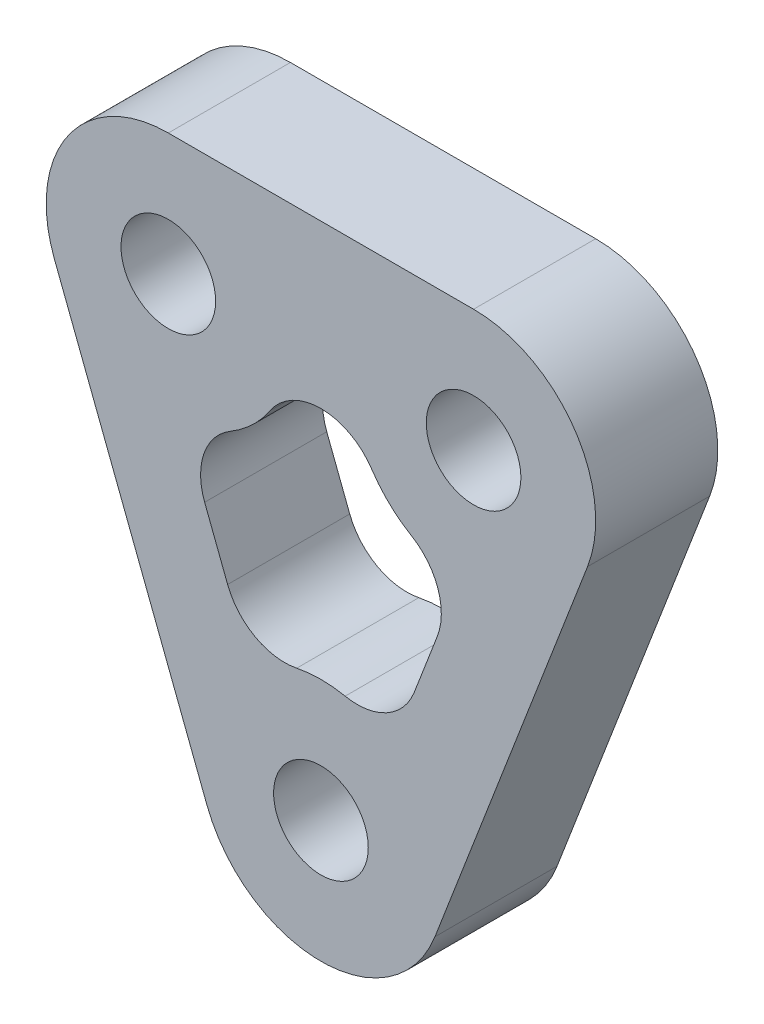
from build123d import *

# Parameters (mm, degrees)
SKETCH_1_R      = 4
SKETCH_1_R_2    = 1.55
EXTRUDE_1_DEPTH = 4
FILLET_1_R      = 2
FILLET_2_R      = 2


with BuildPart() as part:
    # 草图1 → 凸台-拉伸1 (new body)
    # profile 1 of 8: a face of its own
    with BuildSketch(Plane.XY):
        with BuildLine():
            ThreePointArc((-3.733382425, -1.435916317), (-3.830813532, 1.151028966), (-2.323665602, 3.25585291))
            Line((-2.323665602, 3.25585291), (-4.54302561, 9.026188932))
            ThreePointArc((-4.54302561, 9.026188932), (-7.072182387, 9.578587988), (-8.733382425, 11.564083683))
            Line((-8.733382425, 11.564083683), (-3.733382425, -1.435916317))
        make_face()
    # profile 2 of 8: a face of its own
    with BuildSketch(Plane.XY):
        with BuildLine():
            Line((4.54302561, 9.026188932), (2.323665602, 3.25585291))
            ThreePointArc((2.323665602, 3.25585291), (3.556308649, 1.831029436), (4, 0))
            ThreePointArc((4, 0), (3.932780804, -0.730229519), (3.733382425, -1.435916317))
            Line((3.733382425, -1.435916317), (8.733382425, 11.564083683))
            ThreePointArc((8.733382425, 11.564083683), (7.072182387, 9.578587988), (4.54302561, 9.026188932))
        make_face()
    # profile 3 of 8: a face of its own
    with BuildSketch(Plane.XY):
        with Locations((5, 13)):
            Circle(SKETCH_1_R)
        with Locations((5, 13)):
            Circle(SKETCH_1_R_2, mode=Mode.SUBTRACT)
    # profile 4 of 8: a face of its own
    with BuildSketch(Plane.XY):
        with Locations((-5, 13)):
            Circle(SKETCH_1_R)
        with Locations((-5, 13)):
            Circle(SKETCH_1_R_2, mode=Mode.SUBTRACT)
    # profile 5 of 8: a face of its own
    with BuildSketch(Plane.XY):
        with BuildLine():
            Line((-1, 13), (0, 13))
            Line((0, 13), (0, 17))
            Line((0, 17), (-5, 17))
            ThreePointArc((-5, 17), (-2.171572875, 15.828427125), (-1, 13))
        make_face()
    # profile 6 of 8: a face of its own
    with BuildSketch(Plane.XY):
        with BuildLine():
            Line((0, 17), (0, 13))
            Line((0, 13), (1, 13))
            ThreePointArc((1, 13), (2.171572875, 15.828427125), (5, 17))
            Line((5, 17), (0, 17))
        make_face()
    # profile 7 of 8: a face of its own
    with BuildSketch(Plane.XY):
        with BuildLine():
            ThreePointArc((2.323665602, 3.25585291), (1.219956631, 3.809423292), (0, 4))
            ThreePointArc((0, 4), (-1.219956631, 3.809423292), (-2.323665602, 3.25585291))
            ThreePointArc((-2.323665602, 3.25585291), (-3.830813532, 1.151028966), (-3.733382425, -1.435916317))
            ThreePointArc((-3.733382425, -1.435916317), (0, -4), (3.733382425, -1.435916317))
            ThreePointArc((3.733382425, -1.435916317), (3.932780804, -0.730229519), (4, 0))
            ThreePointArc((4, 0), (3.556308649, 1.831029436), (2.323665602, 3.25585291))
        make_face()
        with BuildLine():
            ThreePointArc((1.55, 0), (-1.096015511, -1.096015511), (0, 1.55))
            ThreePointArc((0, 1.55), (1.096015511, 1.096015511), (1.55, 0))
        make_face(mode=Mode.SUBTRACT)
    # profile 8 of 8: a face of its own
    with BuildSketch(Plane.XY):
        with BuildLine():
            ThreePointArc((2.323665602, 3.25585291), (1.219956631, 3.809423292), (0, 4))
            ThreePointArc((0, 4), (-1.219956631, 3.809423292), (-2.323665602, 3.25585291))
            ThreePointArc((-2.323665602, 3.25585291), (-3.830813532, 1.151028966), (-3.733382425, -1.435916317))
            ThreePointArc((-3.733382425, -1.435916317), (0, -4), (3.733382425, -1.435916317))
            ThreePointArc((3.733382425, -1.435916317), (3.932780804, -0.730229519), (4, 0))
            ThreePointArc((4, 0), (3.556308649, 1.831029436), (2.323665602, 3.25585291))
        make_face()
        with BuildLine():
            ThreePointArc((1.55, 0), (-1.096015511, -1.096015511), (0, 1.55))
            ThreePointArc((0, 1.55), (1.096015511, 1.096015511), (1.55, 0))
        make_face(mode=Mode.SUBTRACT)
    extrude(amount=EXTRUDE_1_DEPTH)

    # 圆角1
    # the kernel refuses this fillet: 2 mm, written as the material it adds along each edge
    with BuildSketch(Plane(origin=(-4.54302561, 9.026188932, 0), x_dir=(0.9477918493687586, 0.3188896521841818, 0), z_dir=(0, 0, 1))) as fillet_1_piece_1:
        with BuildLine():
            CenterArc((2.085226569, -1.956035073), FILLET_1_R, 102.035790206, 80.405931773)
            Line((0.087042425, -2.041241452), (0, 0))
            ThreePointArc((0, 0), (0.834090628, -0.087929854), (1.668181255, 0))
        make_face()
    extrude(amount=4)
    with BuildSketch(Plane(origin=(-2.323665602, 3.25585291, 0), x_dir=(-0.3589790793088693, 0.9333456062030594, 0), z_dir=(0, 0, 1)), Plane(origin=(4.54302561, 9.026188932, 0), x_dir=(-0.3589790793088692, -0.9333456062030594, 0), z_dir=(0, 0, 1))) as fillet_1_piece_2:
        with BuildLine():
            CenterArc((2.043096437, -2), FILLET_1_R, 90, 80.405931773)
            ThreePointArc((0.071069843, -1.666666667), (0.123384942, -0.829587241), (0, 0))
            Line((0, 0), (2.043096437, 0))
        make_face()
    extrude(amount=4)
    with BuildSketch(Plane(origin=(2.323665602, 3.25585291, 0), x_dir=(0.35897907930886913, 0.9333456062030596, 0), z_dir=(0, 0, 1))) as fillet_1_piece_3:
        with BuildLine():
            CenterArc((2.043096437, 2), FILLET_1_R, 189.594068227, 80.405931773)
            ThreePointArc((0.071069843, 1.666666667), (0.123384942, 0.829587241), (0, 0))
            Line((0, 0), (2.043096437, 0))
        make_face()
    extrude(amount=4)
    with BuildSketch(Plane(origin=(1, 13, 0), x_dir=(-1, 0, 0), z_dir=(0, 0, 1))) as fillet_1_piece_4:
        with BuildLine():
            CenterArc((1.656854249, 2), FILLET_1_R, 199.471220634, 70.528779366)
            ThreePointArc((-0.228763834, 1.333333333), (-0.057605761, 0.676407915), (0, 0))
            Line((0, 0), (1.656854249, 0))
        make_face()
    extrude(amount=4)
    with BuildSketch(Plane(origin=(-1, 13, 0), x_dir=(-0.16910197872576255, -0.9855985596534887, 0), z_dir=(0, 0, 1))) as fillet_1_piece_5:
        with BuildLine():
            CenterArc((1.691019787, 1.971197119), FILLET_1_R, 189.735610317, 70.528779366)
            Line((-0.280177332, 1.632993162), (0, 0))
            ThreePointArc((0, 0), (0.676407915, 0.057605761), (1.35281583, 0))
        make_face()
    extrude(amount=4)

    # 圆角2
    fillet_2_edges = [part.edges().sort_by_distance(p)[0] for p in [
        (0, 12.889058627, 2),
    ]]
    fillet(fillet_2_edges, radius=FILLET_2_R)


solid = part.part
